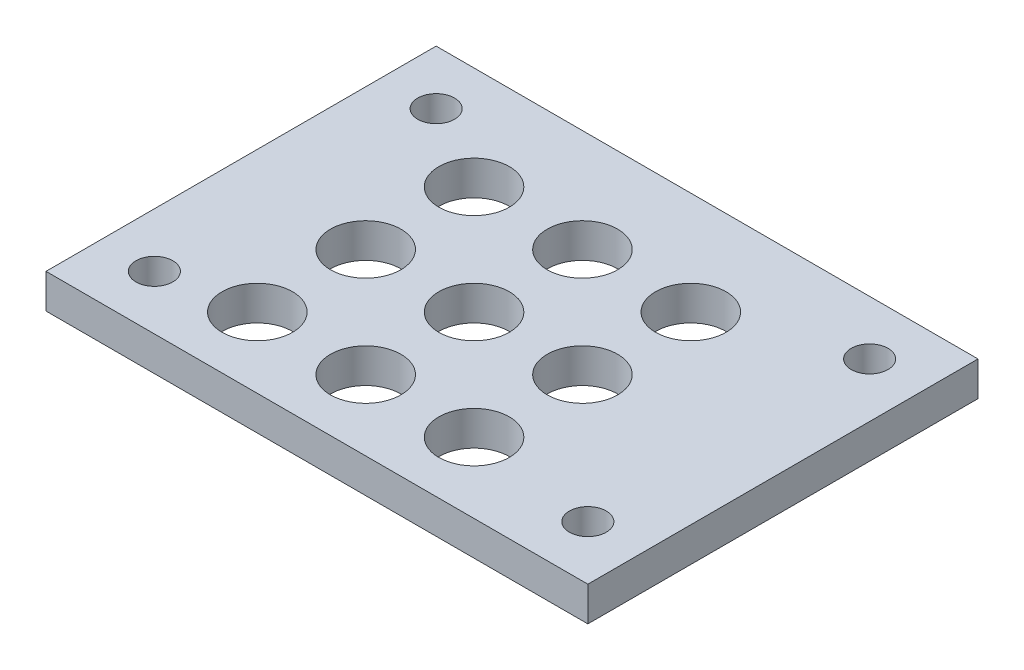
from build123d import *

# Parameters (mm, degrees)
SKETCH1_W           = 50
SKETCH1_H           = 36
SKETCH1_R           = 1.7
SKETCH1_R_2         = 3.25
BOSS_EXTRUDE1_DEPTH = 3.175


with BuildPart() as part:
    # Sketch1 → Boss-Extrude1 (new body)
    with BuildSketch(Plane(origin=(0, 0, 0), x_dir=(1, 0, 0), z_dir=(0, 1, 0))):
        with Locations((25, 18)):
            Rectangle(SKETCH1_W, SKETCH1_H)
        with Locations((5, 5)):
            Circle(SKETCH1_R, mode=Mode.SUBTRACT)
        with Locations((13, 6.5)):
            Circle(SKETCH1_R_2, mode=Mode.SUBTRACT)
        with Locations((23, 6.5)):
            Circle(SKETCH1_R_2, mode=Mode.SUBTRACT)
        with Locations((13, 16.5)):
            Circle(SKETCH1_R_2, mode=Mode.SUBTRACT)
        with Locations((23, 16.5)):
            Circle(SKETCH1_R_2, mode=Mode.SUBTRACT)
        with Locations((33, 6.5)):
            Circle(SKETCH1_R_2, mode=Mode.SUBTRACT)
        with Locations((45, 5)):
            Circle(SKETCH1_R, mode=Mode.SUBTRACT)
        with Locations((33, 16.5)):
            Circle(SKETCH1_R_2, mode=Mode.SUBTRACT)
        with Locations((13, 26.5)):
            Circle(SKETCH1_R_2, mode=Mode.SUBTRACT)
        with Locations((23, 26.5)):
            Circle(SKETCH1_R_2, mode=Mode.SUBTRACT)
        with Locations((5, 31)):
            Circle(SKETCH1_R, mode=Mode.SUBTRACT)
        with Locations((33, 26.5)):
            Circle(SKETCH1_R_2, mode=Mode.SUBTRACT)
        with Locations((45, 31)):
            Circle(SKETCH1_R, mode=Mode.SUBTRACT)
    extrude(amount=BOSS_EXTRUDE1_DEPTH)


solid = part.part
